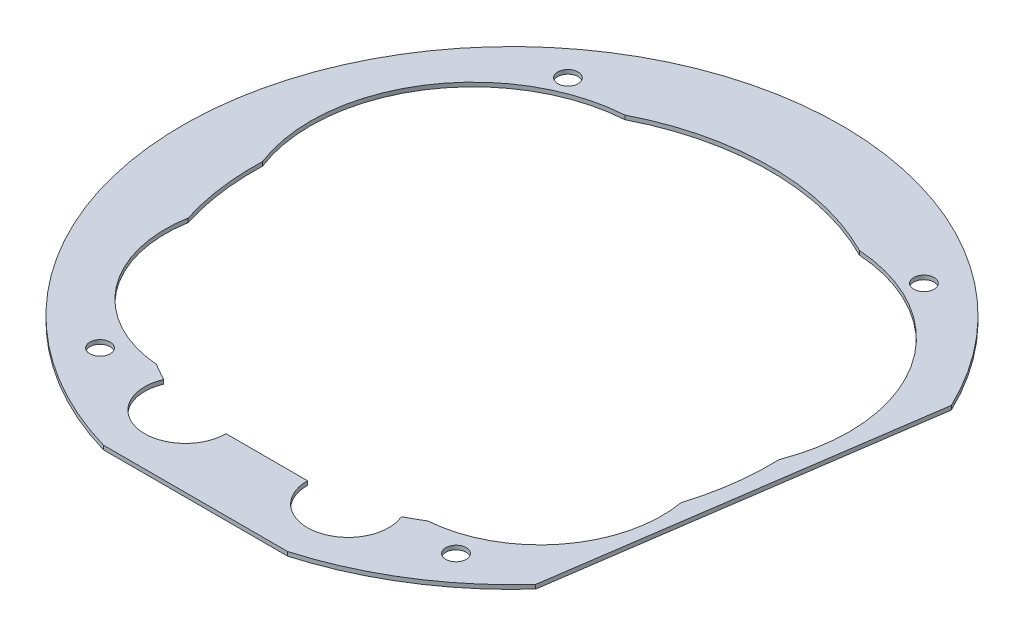
from build123d import *

# Parameters (mm, degrees)
SKETCH1_R           = 1
BOSS_EXTRUDE1_DEPTH = 0.4


with BuildPart() as part:
    # Sketch1 → Boss-Extrude1 (new body)
    with BuildSketch(Plane(origin=(0, 0, 0), x_dir=(1, 0, 0), z_dir=(0, 1, 0))):
        with BuildLine():
            Line((29.237843605, 13.960963482), (24.049079653, -21.711788683))
            ThreePointArc((24.049079653, -21.711788683), (17.208573183, -27.452231403), (9.060814288, -31.107260317))
            Line((9.060814288, -31.107260317), (-9.060814288, -31.107260317))
            ThreePointArc((-9.060814288, -31.107260317), (-24.689356555, 20.980840614), (29.237843605, 13.960963482))
        make_face()
        with Locations((-17.5, 23)):
            Circle(SKETCH1_R, mode=Mode.SUBTRACT)
        with Locations((-17.5, -23)):
            Circle(SKETCH1_R, mode=Mode.SUBTRACT)
        with Locations((17.5, -23)):
            Circle(SKETCH1_R, mode=Mode.SUBTRACT)
        with Locations((17.5, 23)):
            Circle(SKETCH1_R, mode=Mode.SUBTRACT)
        with BuildLine():
            Line((-4, -24.107260317), (4, -24.107260317))
            ThreePointArc((4, -24.107260317), (8.793181532, -28.027829543), (11.685431528, -22.552398764))
            ThreePointArc((11.685431528, -22.552398764), (12.515882132, -22.102323282), (13.329024049, -21.621681662))
            ThreePointArc((13.329024049, -21.621681662), (21.885447224, -17.024628676), (24.236258719, -7.600247582))
            ThreePointArc((24.236258719, -7.600247582), (25.169467159, -3.414370062), (25.385135561, 0.868845523))
            ThreePointArc((25.385135561, 0.868845523), (23.969859677, 15.256089724), (11.535006475, 22.629706706))
            ThreePointArc((11.535006475, 22.629706706), (0, 25.4), (-11.535006475, 22.629706706))
            ThreePointArc((-11.535006475, 22.629706706), (-23.969859677, 15.256089724), (-25.385135561, 0.868845523))
            ThreePointArc((-25.385135561, 0.868845523), (-25.169467159, -3.414370062), (-24.236258719, -7.600247582))
            ThreePointArc((-24.236258719, -7.600247582), (-21.885447224, -17.024628676), (-13.329024049, -21.621681662))
            ThreePointArc((-13.329024049, -21.621681662), (-12.515882132, -22.102323282), (-11.685431528, -22.552398764))
            ThreePointArc((-11.685431528, -22.552398764), (-8.793181532, -28.027829543), (-4, -24.107260317))
        make_face(mode=Mode.SUBTRACT)
    extrude(amount=BOSS_EXTRUDE1_DEPTH)


solid = part.part
